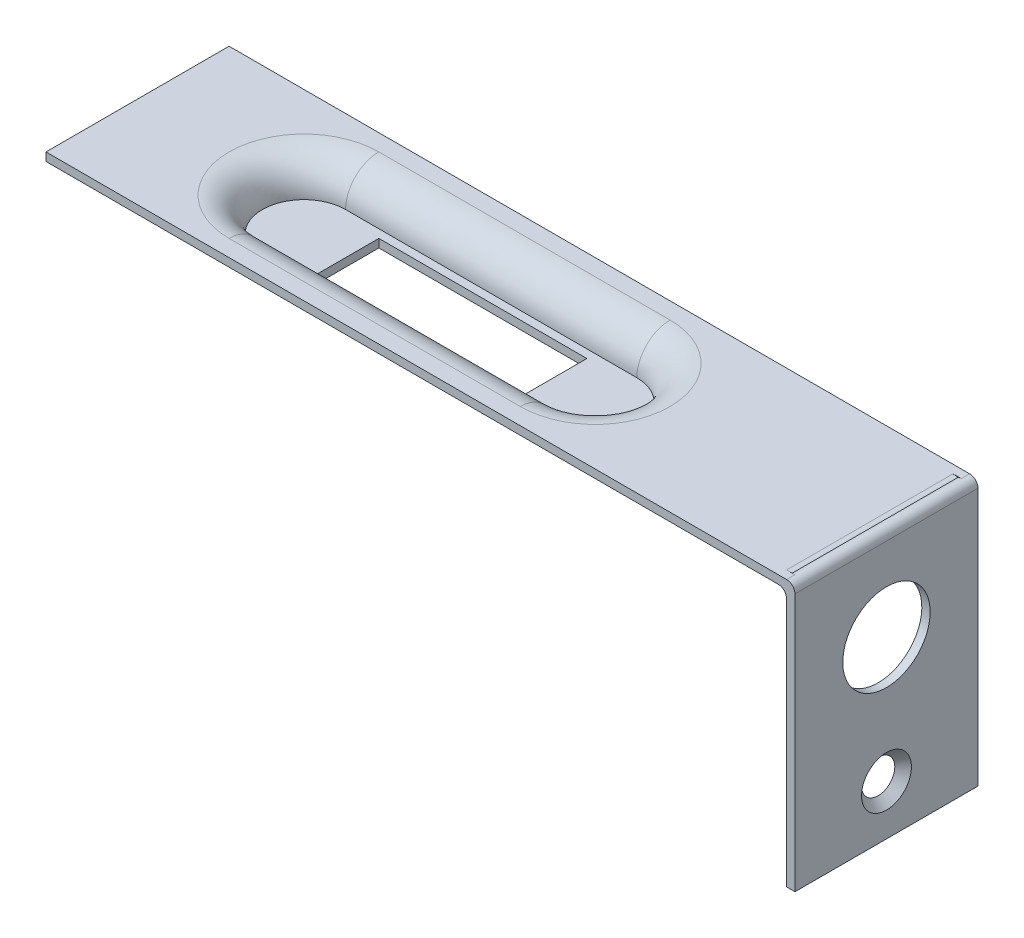
from build123d import *

# Parameters (mm, degrees)
BOSS_EXTRUDE1_DEPTH      = 11
BOSS_EXTRUDE1_DEPTH_BACK = 11
CUT_EXTRUDE1_REACH       = 98.151
SKETCH2_R                = 5.25
SKETCH2_R_2              = 2
BOSS_EXTRUDE2_DEPTH      = 4
FILLET1_R                = 3
FILLET2_R                = 1
SHELL1_START             = -24.5
SHELL1_DEPTH             = 35
SHELL1_START_2           = -10
SHELL1_2_DEPTH           = 20
CUT_EXTRUDE2_REACH       = 56.546
SKETCH4_W                = 25
SKETCH4_H                = 8
CHAMFER1_SIZE            = 1
DELETEFACE2_START        = -10
DELETEFACE2_DEPTH        = 20


with BuildPart() as part:
    # Sketch1 → Boss-Extrude1 (new, two sides: drawn at the far end of the back side and taken through both)
    with BuildSketch(Plane.XY.offset(-BOSS_EXTRUDE1_DEPTH_BACK)):
        with BuildLine():
            Line((-44.5, 0), (-44.5, -1))
            Line((-44.5, -1), (43.5, -1))
            ThreePointArc((43.5, -1), (44.207106781, -1.292893219), (44.5, -2))
            Line((44.5, -2), (44.5, -32))
            Line((44.5, -32), (45.5, -32))
            Line((45.5, -32), (45.5, -1))
            ThreePointArc((45.5, -1), (45.207106781, -0.292893219), (44.5, 0))
            Line((44.5, 0), (-44.5, 0))
        make_face()
    extrude(amount=BOSS_EXTRUDE1_DEPTH + BOSS_EXTRUDE1_DEPTH_BACK)

    # Sketch2 → Cut-Extrude1 (cut, up to next)
    with BuildSketch(Plane(origin=(45.5, 0, 0), x_dir=(0, 0, -1), z_dir=(1, 0, 0)), mode=Mode.PRIVATE) as cut_extrude1_sk1:
        with Locations(Location((0, -11, 0), (0, 0, 90))):
            Circle(SKETCH2_R)
    cut_extrude1_tool1 = extrude(cut_extrude1_sk1.sketch, amount=-CUT_EXTRUDE1_REACH, mode=Mode.PRIVATE) & part.part
    # Sketch2 → Cut-Extrude1 (cut, up to next)
    with BuildSketch(Plane(origin=(45.5, 0, 0), x_dir=(0, 0, -1), z_dir=(1, 0, 0)), mode=Mode.PRIVATE) as cut_extrude1_sk2:
        with Locations(Location((0, -26, 0), (0, 0, 90))):
            Circle(SKETCH2_R_2)
    cut_extrude1_tool2 = extrude(cut_extrude1_sk2.sketch, amount=-CUT_EXTRUDE1_REACH, mode=Mode.PRIVATE) & part.part
    add(cut_extrude1_tool1.solids().sort_by_distance((45.5, -11, 0))[0], mode=Mode.SUBTRACT)
    add(cut_extrude1_tool2.solids().sort_by_distance((45.5, -26, 0))[0], mode=Mode.SUBTRACT)

    # Sketch3 → Boss-Extrude2 (add)
    with BuildSketch(Plane.XZ.offset(1)):
        with BuildLine():
            Line((10.5, -6), (-24.5, -6))
            ThreePointArc((-24.5, -6), (-30.5, 0), (-24.5, 6))
            Line((-24.5, 6), (10.5, 6))
            ThreePointArc((10.5, 6), (16.5, 0), (10.5, -6))
        make_face()
    extrude(amount=BOSS_EXTRUDE2_DEPTH)

    # Fillet1
    fillet1_edges = [part.edges().sort_by_distance(p)[0] for p in [
        (16.5, -1, 0),
        (-7, -1, 6),
        (-30.5, -1, 0),
        (-7, -1, -6),
    ]]
    fillet(fillet1_edges, radius=FILLET1_R)

    # Fillet2
    fillet2_edges = [part.edges().sort_by_distance(p)[0] for p in [
        (16.5, -5, 0),
        (-7, -5, -6),
        (-30.5, -5, 0),
        (-7, -5, 6),
    ]]
    fillet(fillet2_edges, radius=FILLET2_R - 0.0001)  # a hair under: the kernel refuses the full size

    # Shell1: read off the stored shape, not the designer's step
    # Shell1 outline → Shell1 (cut)
    with BuildSketch(Plane.YZ.offset(SHELL1_START)):
        with BuildLine():
            Line((0, -9), (0, 9))
            ThreePointArc((0, 9), (-1.171572875, 6.171572875), (-4, 5))
            Line((-4, 5), (-4, -5))
            ThreePointArc((-4, -5), (-1.171572875, -6.171572875), (0, -9))
        make_face()
    extrude(amount=SHELL1_DEPTH, mode=Mode.SUBTRACT)

    # Shell1 2 outline → Shell1 2 (cut)
    with BuildSketch(Plane.XY.offset(SHELL1_START_2)):
        with BuildLine():
            ThreePointArc((43.5, 0), (44.01763809, -0.068148347), (44.5, -0.267949192))
            Line((44.5, -0.267949192), (44.5, 0))
            Line((44.5, 0), (43.5, 0))
        make_face()
    extrude(amount=SHELL1_2_DEPTH, mode=Mode.SUBTRACT)

    # Shell1 3 outline → Shell1 3 (revolve, cut)
    with BuildSketch(Plane(origin=(10.5, 0, 0), x_dir=(1, 0, 0), z_dir=(0, 0, 1))):
        with BuildLine():
            Line((9, 0), (0, 0))
            Line((0, 0), (0, -4))
            Line((0, -4), (5, -4))
            ThreePointArc((5, -4), (6.171572875, -1.171572875), (9, 0))
        make_face()
    revolve(axis=Axis((10.5, 0, 0), (0, 1, 0)), mode=Mode.SUBTRACT)

    # Shell1 4 outline → Shell1 4 (revolve, cut)
    with BuildSketch(Plane(origin=(-24.5, 0, 0), x_dir=(1, 0, 0), z_dir=(0, 0, 1))):
        with BuildLine():
            Line((9, 0), (0, 0))
            Line((0, 0), (0, -4))
            Line((0, -4), (5, -4))
            ThreePointArc((5, -4), (6.171572875, -1.171572875), (9, 0))
        make_face()
    revolve(axis=Axis((-24.5, 0, 0), (0, 1, 0)), mode=Mode.SUBTRACT)

    # Sketch4 → Cut-Extrude2 (cut, up to next)
    with BuildSketch(Plane(origin=(0, -4, 0), x_dir=(1, 0, 0), z_dir=(0, 1, 0)), mode=Mode.PRIVATE) as cut_extrude2_sk1:
        with Locations((-7, 0)):
            Rectangle(SKETCH4_W, SKETCH4_H)
    cut_extrude2_tool1 = extrude(cut_extrude2_sk1.sketch, amount=-CUT_EXTRUDE2_REACH, mode=Mode.PRIVATE) & part.part
    add(cut_extrude2_tool1.solids().sort_by_distance((-7, -4, 0))[0], mode=Mode.SUBTRACT)

    # Chamfer1
    chamfer1_edges = [part.edges().sort_by_distance(p)[0] for p in [
        (45.5, -28, 0),
    ]]
    chamfer(chamfer1_edges, length=CHAMFER1_SIZE - 0.0001)  # a hair under: the kernel refuses the full size

    # DeleteFace2: read off the stored shape, not the designer's step
    # DeleteFace2 outline → DeleteFace2 (add)
    with BuildSketch(Plane.XY.offset(DELETEFACE2_START)):
        with BuildLine():
            Line((44.5, -0.267949192), (44.5, 0))
            ThreePointArc((44.5, 0), (44.289569284, -0.022391226), (44.088562172, -0.088562172))
            ThreePointArc((44.088562172, -0.088562172), (44.299329325, -0.166677161), (44.5, -0.267949192))
        make_face()
    extrude(amount=DELETEFACE2_DEPTH)


solid = part.part
